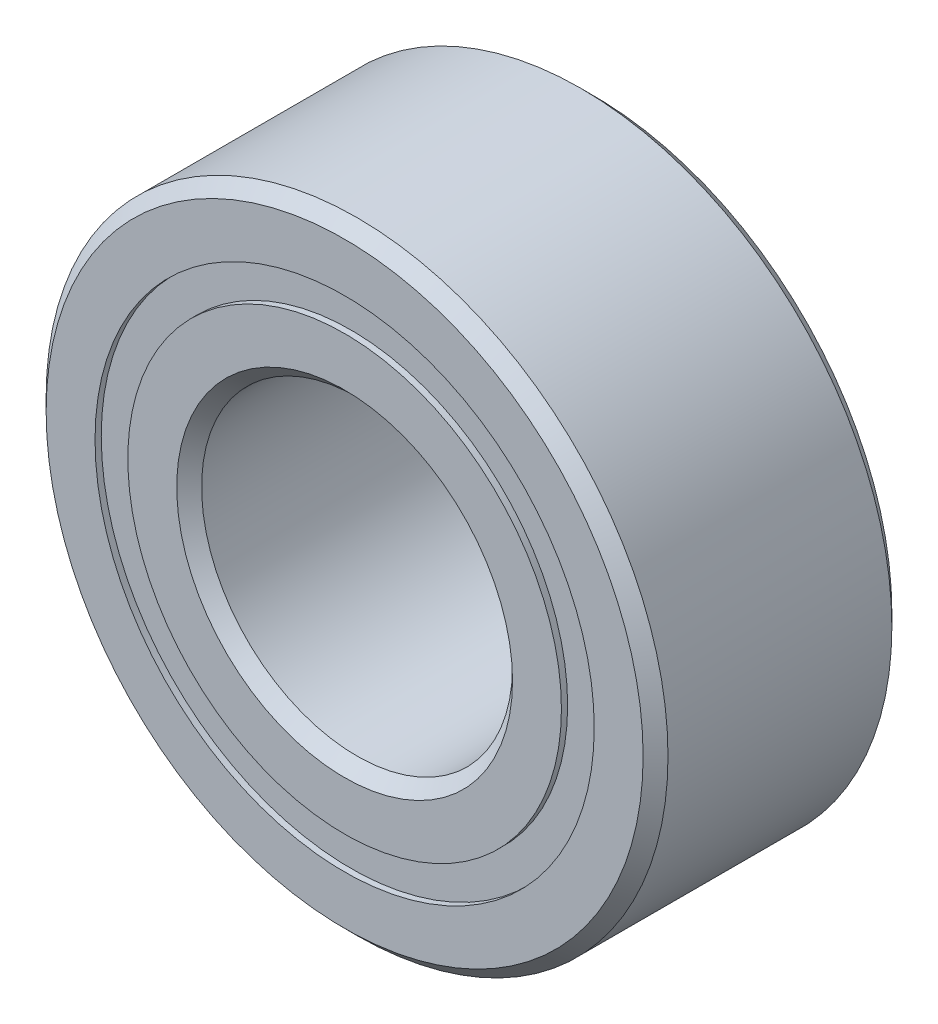
from build123d import *

# Parameters (mm, degrees)
CIRPATTERN1_COUNT = 12
SKETCH5_W         = 0.772168375
SKETCH5_H         = 0.418681318


with BuildPart() as part:
    # Sketch1 → Revolve1 (revolve)
    with BuildSketch(Plane(origin=(0, 0, 0), x_dir=(0, 0, -1), z_dir=(1, 0, 0))):
        with BuildLine():
            Line((1.42875, 3.96875), (-1.42875, 3.96875))
            Line((-1.42875, 3.96875), (-1.5875, 3.81))
            Line((-1.5875, 3.81), (-1.5875, 3.185903159))
            Line((-1.5875, 3.185903159), (-0.705555556, 3.185903159))
            ThreePointArc((-0.705555556, 3.185903159), (0, 3.712519125), (0.705555556, 3.185903159))
            Line((0.705555556, 3.185903159), (1.5875, 3.185903159))
            Line((1.5875, 3.185903159), (1.5875, 3.81))
            Line((1.5875, 3.81), (1.42875, 3.96875))
        make_face()
    revolve(axis=Axis((0, 0, 1.5875), (0, 0, -1)))


with BuildPart() as body_2:
    # Sketch3 → Revolve3 (revolve)
    with BuildSketch(Plane(origin=(0, 0, 0), x_dir=(0, 0, -1), z_dir=(1, 0, 0))):
        with BuildLine():
            Line((-0.705555556, 2.767221841), (-1.5875, 2.767221841))
            Line((-1.5875, 2.767221841), (-1.5875, 2.143125))
            Line((-1.5875, 2.143125), (-1.42875, 1.984375))
            Line((-1.42875, 1.984375), (1.42875, 1.984375))
            Line((1.42875, 1.984375), (1.5875, 2.143125))
            Line((1.5875, 2.143125), (1.5875, 2.767221841))
            Line((1.5875, 2.767221841), (0.705555556, 2.767221841))
            ThreePointArc((0.705555556, 2.767221841), (0, 2.240605875), (-0.705555556, 2.767221841))
        make_face()
    revolve(axis=Axis((0, 0, 1.5875), (0, 0, -1)))


with BuildPart() as body_3:
    # Sketch4 → Revolve4 (revolve)
    with BuildSketch(Plane(origin=(0, 0, 0), x_dir=(0, 0, -1), z_dir=(1, 0, 0))):
        with BuildLine():
            Line((-0.735956625, 2.9765625), (0.735956625, 2.9765625))
            ThreePointArc((0.735956625, 2.9765625), (0, 3.712519125), (-0.735956625, 2.9765625))
        make_face()
    revolve(axis=Axis((0, 2.9765625, 0.735956625), (0, 0, -1)))


with BuildPart() as cirpattern1_1:
    # CirPattern1: pattern copy
    add(body_3.part.rotate(Axis((0, 0, -1.5875), (0, 0, 1)), 1 * 360 / CIRPATTERN1_COUNT))


with BuildPart() as cirpattern1_2:
    # CirPattern1: pattern copy
    add(body_3.part.rotate(Axis((0, 0, -1.5875), (0, 0, 1)), 2 * 360 / CIRPATTERN1_COUNT))


with BuildPart() as cirpattern1_3:
    # CirPattern1: pattern copy
    add(body_3.part.rotate(Axis((0, 0, -1.5875), (0, 0, 1)), 3 * 360 / CIRPATTERN1_COUNT))


with BuildPart() as cirpattern1_4:
    # CirPattern1: pattern copy
    add(body_3.part.rotate(Axis((0, 0, -1.5875), (0, 0, 1)), 4 * 360 / CIRPATTERN1_COUNT))


with BuildPart() as cirpattern1_5:
    # CirPattern1: pattern copy
    add(body_3.part.rotate(Axis((0, 0, -1.5875), (0, 0, 1)), 5 * 360 / CIRPATTERN1_COUNT))


with BuildPart() as cirpattern1_6:
    # CirPattern1: pattern copy
    add(body_3.part.rotate(Axis((0, 0, -1.5875), (0, 0, 1)), 6 * 360 / CIRPATTERN1_COUNT))


with BuildPart() as cirpattern1_7:
    # CirPattern1: pattern copy
    add(body_3.part.rotate(Axis((0, 0, -1.5875), (0, 0, 1)), 7 * 360 / CIRPATTERN1_COUNT))


with BuildPart() as cirpattern1_8:
    # CirPattern1: pattern copy
    add(body_3.part.rotate(Axis((0, 0, -1.5875), (0, 0, 1)), 8 * 360 / CIRPATTERN1_COUNT))


with BuildPart() as cirpattern1_9:
    # CirPattern1: pattern copy
    add(body_3.part.rotate(Axis((0, 0, -1.5875), (0, 0, 1)), 9 * 360 / CIRPATTERN1_COUNT))


with BuildPart() as cirpattern1_10:
    # CirPattern1: pattern copy
    add(body_3.part.rotate(Axis((0, 0, -1.5875), (0, 0, 1)), 10 * 360 / CIRPATTERN1_COUNT))


with BuildPart() as cirpattern1_11:
    # CirPattern1: pattern copy
    add(body_3.part.rotate(Axis((0, 0, -1.5875), (0, 0, 1)), 11 * 360 / CIRPATTERN1_COUNT))


with BuildPart() as body_15:
    # Sketch5 → Revolve5 (revolve)
    with BuildSketch(Plane(origin=(0, 0, 0), x_dir=(0, 0, -1), z_dir=(1, 0, 0))):
        with Locations((-1.122040813, 2.9765625)):
            Rectangle(SKETCH5_W, SKETCH5_H)
        with Locations((1.122040813, 2.9765625)):
            Rectangle(SKETCH5_W, SKETCH5_H)
    revolve(axis=Axis((0, 0, 1.5875), (0, 0, -1)))


solid = Compound([part.part, body_2.part, body_3.part, cirpattern1_1.part, cirpattern1_2.part, cirpattern1_3.part, cirpattern1_4.part, cirpattern1_5.part, cirpattern1_6.part, cirpattern1_7.part, cirpattern1_8.part, cirpattern1_9.part, cirpattern1_10.part, cirpattern1_11.part, body_15.part])
